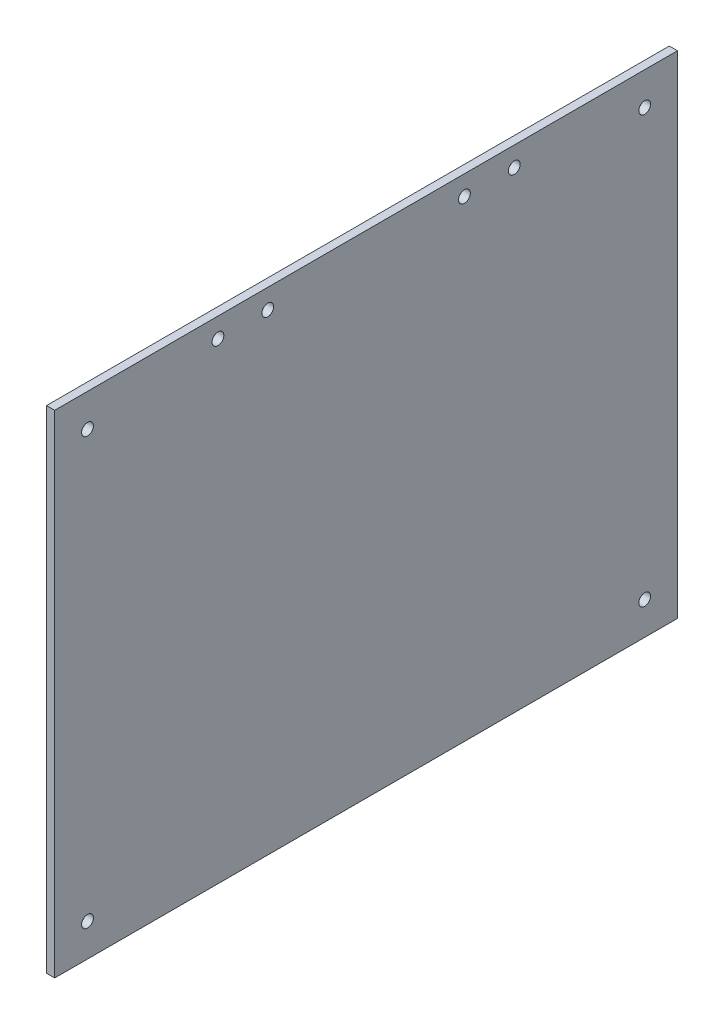
from build123d import *

# Parameters (mm, degrees)
SKETCH1_W           = 241.3
SKETCH1_H           = 190.5
BOSS_EXTRUDE1_DEPTH = 3.175
SKETCH2_R           = 2.286
CUT_EXTRUDE1_DEPTH  = 308.450842616
SKETCH3_R           = 2.286
CUT_EXTRUDE2_DEPTH  = 308.450842616


with BuildPart() as part:
    # Sketch1 → Boss-Extrude1 (new body)
    with BuildSketch(Plane(origin=(0, 0, 0), x_dir=(0, 0, -1), z_dir=(1, 0, 0))):
        with Locations((120.65, 95.25)):
            Rectangle(SKETCH1_W, SKETCH1_H)
    extrude(amount=BOSS_EXTRUDE1_DEPTH)

    # Sketch2 → Cut-Extrude1 (cut, through all)
    with BuildSketch(Plane(origin=(3.175, 0, 0), x_dir=(0, 0, -1), z_dir=(1, 0, 0))):
        with Locations((228.6, 12.7)):
            Circle(SKETCH2_R)
        with Locations((228.6, 177.8)):
            Circle(SKETCH2_R)
        with Locations((12.7, 12.7)):
            Circle(SKETCH2_R)
        with Locations((12.7, 177.8)):
            Circle(SKETCH2_R)
    extrude(amount=-CUT_EXTRUDE1_DEPTH, mode=Mode.SUBTRACT)

    # Sketch3 → Cut-Extrude2 (cut, through all)
    with BuildSketch(Plane(origin=(3.175, 0, 0), x_dir=(0, 0, -1), z_dir=(1, 0, 0))):
        with Locations((63.246, 182.88)):
            Circle(SKETCH3_R)
        with Locations((82.55, 182.88)):
            Circle(SKETCH3_R)
        with Locations((158.75, 182.88)):
            Circle(SKETCH3_R)
        with Locations((178.054, 182.88)):
            Circle(SKETCH3_R)
    extrude(amount=-CUT_EXTRUDE2_DEPTH, mode=Mode.SUBTRACT)


solid = part.part
